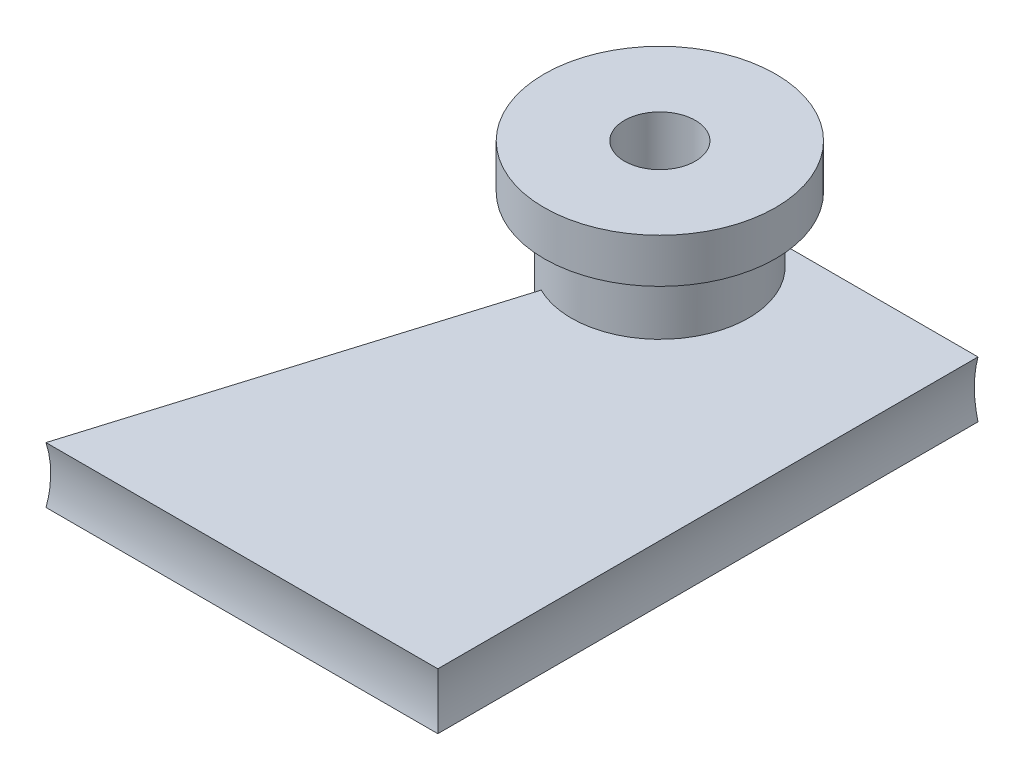
from build123d import *

# Parameters (mm, degrees)
BOSS_EXTRUDE1_DEPTH     = 6.35
SKETCH1_3_R             = 4
BOSS_EXTRUDE2_DEPTH     = 18.7
CUT_EXTRUDE1_DEPTH      = 55.725212189
CUT_EXTRUDE1_DEPTH_BACK = 55.725212189
SKETCH3_R               = 12.5
CUT_EXTRUDE3_DEPTH      = 55.725212189
CUT_EXTRUDE3_DEPTH_BACK = 55.725212189
SKETCH4_R               = 12.5
BOSS_EXTRUDE3_START     = -5
BOSS_EXTRUDE3_DEPTH     = 5


with BuildPart() as part:
    # Sketch1 → Boss-Extrude1 (new body)
    with BuildSketch(Plane(origin=(0, 0, 0), x_dir=(1, 0, 0), z_dir=(0, 1, 0))):
        with BuildLine():
            Line((30.820134884, -20.651845529), (30.820134884, 40.348154471))
            Line((30.820134884, 40.348154471), (8.047984633, 40.348154471))
            ThreePointArc((8.047984633, 40.348154471), (12.429487205, 36.660674511), (14.069240868, 31.173755414))
            ThreePointArc((14.069240868, 31.173755414), (9.338469296, 22.674624178), (-0.377805487, 22.216982629))
            Line((-0.377805487, 22.216982629), (-13.427648664, -20.651845529))
            Line((-13.427648664, -20.651845529), (30.820134884, -20.651845529))
        make_face()
    extrude(amount=BOSS_EXTRUDE1_DEPTH)

    # Sketch1<3> → Boss-Extrude2 (add)
    with BuildSketch(Plane(origin=(0, 0, 0), x_dir=(1, 0, 0), z_dir=(0, 1, 0))):
        with BuildLine():
            ThreePointArc((14.069240868, 31.173755414), (12.429487205, 36.660674511), (8.047984633, 40.348154471))
            ThreePointArc((8.047984633, 40.348154471), (-4.999368448, 35.388055485), (-0.377805487, 22.216982629))
            ThreePointArc((-0.377805487, 22.216982629), (9.338469296, 22.674624178), (14.069240868, 31.173755414))
        make_face()
        with Locations((4.069240868, 31.173755414)):
            Circle(SKETCH1_3_R, mode=Mode.SUBTRACT)
    extrude(amount=BOSS_EXTRUDE2_DEPTH)

    # Sketch3 → Cut-Extrude1 (cut, two sides: drawn at the far end of the back side and taken through both)
    with BuildSketch(Plane.XY.offset(-CUT_EXTRUDE1_DEPTH_BACK)):
        with Locations((42.910187614, 3.175)):
            Circle(SKETCH3_R)
    extrude(amount=CUT_EXTRUDE1_DEPTH + CUT_EXTRUDE1_DEPTH_BACK, mode=Mode.SUBTRACT)

    # Sketch4 → Cut-Extrude3 (cut, two sides: drawn at the far end of the back side and taken through both)
    with BuildSketch(Plane(origin=(0, 0, 0), x_dir=(0, 0, -1), z_dir=(1, 0, 0)).offset(-CUT_EXTRUDE3_DEPTH_BACK)):
        with Locations((-32.741898259, 3.175)):
            Circle(SKETCH4_R)
    extrude(amount=CUT_EXTRUDE3_DEPTH + CUT_EXTRUDE3_DEPTH_BACK, mode=Mode.SUBTRACT)

    # Sketch5 → Boss-Extrude3 (add)
    with BuildSketch(Plane(origin=(0, 18.7, 0), x_dir=(1, 0, 0), z_dir=(0, 1, 0)).offset(BOSS_EXTRUDE3_START)):
        with BuildLine():
            ThreePointArc((17.138481403, 31.173755414), (4.069240868, 44.242995949), (-8.999999668, 31.173755414))
            ThreePointArc((-8.999999668, 31.173755414), (0.057560604, 18.735448872), (14.675663691, 23.537732688))
            ThreePointArc((14.675663691, 23.537732688), (16.50754741, 27.16207515), (17.138481403, 31.173755414))
        make_face()
        with BuildLine():
            ThreePointArc((14.069240868, 31.173755414), (13.300017647, 27.327619683), (11.110688856, 24.073191336))
            ThreePointArc((11.110688856, 24.073191336), (-5.161535911, 35.019891144), (14.069240868, 31.173755414))
        make_face(mode=Mode.SUBTRACT)
    extrude(amount=BOSS_EXTRUDE3_DEPTH)


solid = part.part
